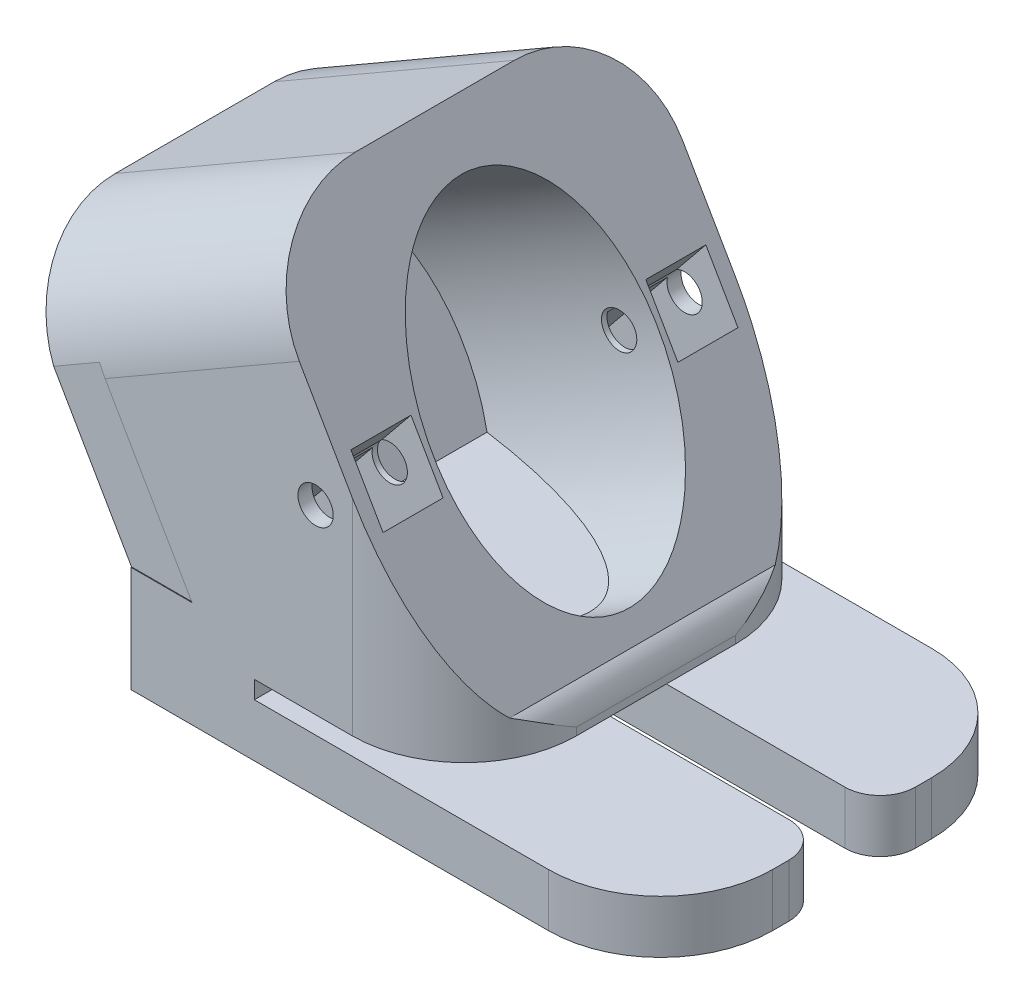
from build123d import *

# Parameters (mm, degrees)
SKETCH2_W           = 21.7
SKETCH2_H           = 25.05
SKETCH2_RX          = 9.525
SKETCH2_RY          = 6.35
BOSS_EXTRUDE1_DEPTH = 12.7
SKETCH3_W           = 21.660653916
SKETCH3_H           = 25.05
BOSS_EXTRUDE2_DEPTH = 3
SKETCH5_W           = 18.892037138
SKETCH5_H           = 21.7
BOSS_EXTRUDE3_DEPTH = 2
SKETCH6_W           = 30
SKETCH6_H           = 21.7
BOSS_EXTRUDE4_DEPTH = 4
SKETCH7_W           = 21.7
SKETCH7_H           = 1
SKETCH7_W_2         = 3.175
SKETCH7_H_2         = 3
CUT_EXTRUDE2_DEPTH  = 23
SKETCH7_3_W         = 21.7
SKETCH7_3_H         = 7.272473706
CUT_EXTRUDE3_DEPTH  = 44.803879418
SKETCH11_R          = 1
CUT_EXTRUDE8_DEPTH  = 33.487034031
CUT_EXTRUDE4_REACH  = 47.088
SKETCH9_R           = 1
SKETCH15_W          = 3.4
SKETCH15_H          = 3.4
CUT_EXTRUDE9_DEPTH  = 28.443249332
FILLET5_R           = 6.35
FILLET6_R           = 2
FILLET7_R           = 2


with BuildPart() as part:
    # Sketch2 → Boss-Extrude1 (new body)
    with BuildSketch(Plane(origin=(16.497783942, 9.525, 0), x_dir=(0, 0, -1), z_dir=(0.8660254037844379, 0.5000000000000013, 0))):
        Rectangle(SKETCH2_W, SKETCH2_H)
        with Locations(Location((0, 0), (0, 0, 90))):
            Ellipse(SKETCH2_RX, SKETCH2_RY, mode=Mode.SUBTRACT)
    extrude(amount=-BOSS_EXTRUDE1_DEPTH)

    # Sketch3 → Boss-Extrude2 (add)
    with BuildSketch(Plane(origin=(5.499261314, 3.175, 0), x_dir=(0, 0, 1), z_dir=(-0.8660254037844379, -0.5000000000000014, 0))):
        with Locations((-0.019673042, 0)):
            Rectangle(SKETCH3_W, SKETCH3_H)
    extrude(amount=BOSS_EXTRUDE2_DEPTH)

    # Sketch5 → Boss-Extrude3 (add)
    with BuildSketch(Plane(origin=(0, 0, 0), x_dir=(-1, 0, 0), z_dir=(0, 1, 0))):
        with Locations((-13.314265373, 0)):
            Rectangle(SKETCH5_W, SKETCH5_H)
    extrude(amount=-BOSS_EXTRUDE3_DEPTH)

    # Sketch6 → Boss-Extrude4 (add)
    with BuildSketch(Plane.XZ.offset(2)):
        with Locations((18.868246804, 0)):
            Rectangle(SKETCH6_W, SKETCH6_H)
    extrude(amount=BOSS_EXTRUDE4_DEPTH)

    # Sketch7 → Cut-Extrude2 (cut)
    with BuildSketch(Plane(origin=(33.868246804, 0, 0), x_dir=(0, 0, -1), z_dir=(1, 0, 0))):
        with Locations((0, -2.5)):
            Rectangle(SKETCH7_W, SKETCH7_H)
        with Locations((0, -4.5)):
            Rectangle(SKETCH7_W_2, SKETCH7_H_2)
    extrude(amount=-CUT_EXTRUDE2_DEPTH, mode=Mode.SUBTRACT)

    # Sketch7<3> → Cut-Extrude3 (cut, through all)
    with BuildSketch(Plane(origin=(33.868246804, 0, 0), x_dir=(0, 0, -1), z_dir=(1, 0, 0))):
        with Locations((0, -9.636236853)):
            Rectangle(SKETCH7_3_W, SKETCH7_3_H)
    extrude(amount=-CUT_EXTRUDE3_DEPTH, mode=Mode.SUBTRACT)

    # Sketch11 → Cut-Extrude8 (cut, through all)
    with BuildSketch(Plane(origin=(19.672783942, 0.194872981, 0), x_dir=(0, 0, -1), z_dir=(-1, 0, 0))):
        with Locations(Location((0, -3.830865705, 0), (0, 0, 90))):
            Circle(SKETCH11_R)
    extrude(amount=CUT_EXTRUDE8_DEPTH, mode=Mode.SUBTRACT)

    # Sketch9 → Cut-Extrude4 (cut, up to next)
    with BuildSketch(Plane(origin=(0, 0, -10.85), x_dir=(-1, 0, 0), z_dir=(0, 0, -1)), mode=Mode.PRIVATE) as cut_extrude4_sk1:
        with Locations((-14.332720433, 8.275)):
            Circle(SKETCH9_R)
    cut_extrude4_tool1 = extrude(cut_extrude4_sk1.sketch, amount=-CUT_EXTRUDE4_REACH, mode=Mode.PRIVATE) & part.part
    cut_extrude4 = cut_extrude4_tool1.solids().sort_by_distance((14.33272, 8.275, -10.85))[0]
    add(cut_extrude4, mode=Mode.SUBTRACT)

    # Sketch15 → Cut-Extrude9 (cut, symmetric)
    with BuildSketch(Plane(origin=(16.497783942, 9.525, 0), x_dir=(0.7757354378747654, -0.6310582623064579, 0), z_dir=(0.6310582623064579, 0.7757354378747654, 0))):
        with Locations((-0.1, -8.35)):
            Rectangle(SKETCH15_W, SKETCH15_H)
    cut_extrude9 = extrude(amount=CUT_EXTRUDE9_DEPTH, both=True, mode=Mode.SUBTRACT)

    # Mirror1: Cut-Extrude4, Cut-Extrude9 across plane
    add(cut_extrude4.mirror(Plane.XY), mode=Mode.SUBTRACT)
    add(cut_extrude9.mirror(Plane.XY), mode=Mode.SUBTRACT)

    # Fillet5
    fillet5_edges = [part.edges().sort_by_distance(p)[0] for p in [
        (33.868246804, -4.5, 10.85),
        (33.868246804, -4.5, -10.85),
        (22.760283942, -1, -10.85),
        (22.760283942, -1, 10.85),
        (4.736022628, 17.196968182, 10.85),
        (3.436984522, 16.446968182, -10.85),
    ]]
    fillet(fillet5_edges, radius=FILLET5_R)

    # Fillet6
    fillet6_edges = [part.edges().sort_by_distance(p)[0] for p in [
        (33.868246804, -4.5, 1.5875),
        (33.868246804, -4.5, -1.5875),
    ]]
    fillet(fillet6_edges, radius=FILLET6_R)

    # Fillet7
    # the kernel refuses this fillet: 2 mm, written as the material it takes off along each edge
    with BuildSketch(Plane(origin=(22.760283942, 0, 8.429393602), x_dir=(-1, 0, 0), z_dir=(0, 0, -1))) as fillet7_piece_1:
        with BuildLine():
            CenterArc((2, -1.571757441), FILLET7_R, 128.197977663, 51.802022337)
            Line((0, -1.571757441), (-0.04, -1.571757441))
            Line((-0.04, -1.571757441), (-0.04, 0))
            Line((-0.04, 0), (0, 0.04))
            ThreePointArc((0, 0.04), (0.381619343, 0.04), (0.73850346, 0.031435149))
            Line((0.73850346, 0.031435149), (0.763238686, 0))
        make_face()
    extrude(amount=16.858787203, mode=Mode.SUBTRACT)


solid = part.part
